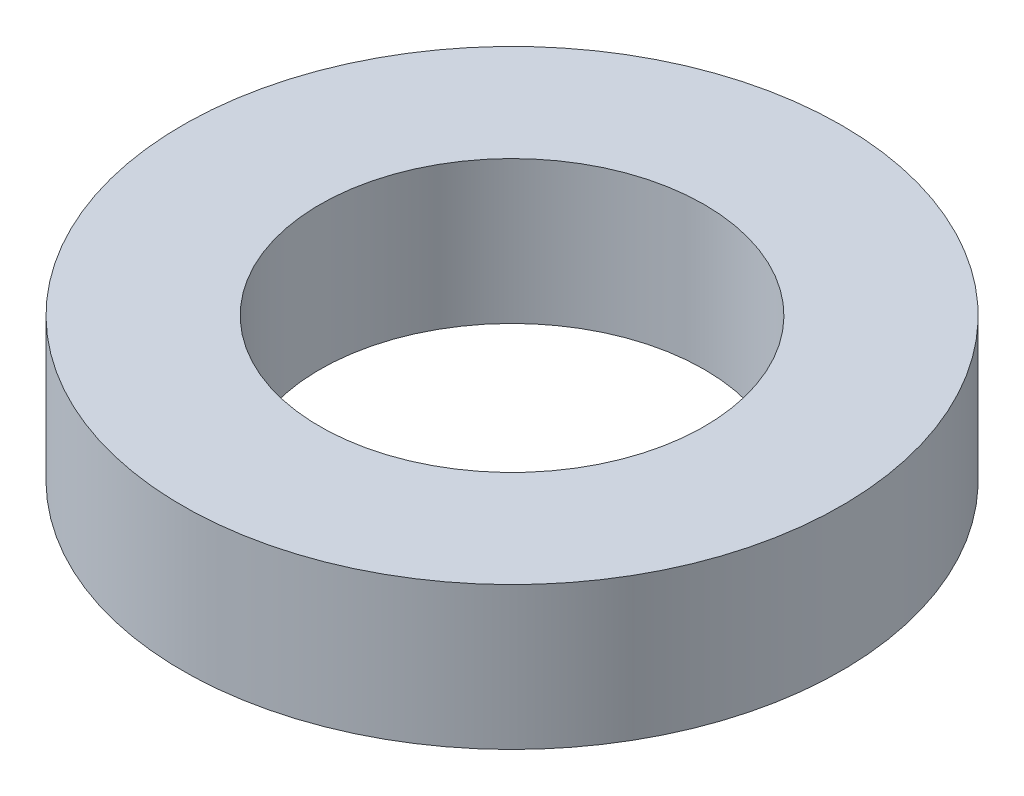
from build123d import *

# Parameters (mm, degrees)
SKETCH1_R           = 30
BOSS_EXTRUDE1_DEPTH = 13
SKETCH2_R           = 17.5
CUT_EXTRUDE1_DEPTH  = 45.373415465


with BuildPart() as part:
    # Sketch1 → Boss-Extrude1 (new body)
    with BuildSketch(Plane(origin=(0, 0, 0), x_dir=(1, 0, 0), z_dir=(0, 1, 0))):
        Circle(SKETCH1_R)
    extrude(amount=BOSS_EXTRUDE1_DEPTH)

    # Sketch2 → Cut-Extrude1 (cut, through all)
    with BuildSketch(Plane(origin=(0, 0, 0), x_dir=(1, 0, 0), z_dir=(0, 1, 0))):
        Circle(SKETCH2_R)
    extrude(amount=CUT_EXTRUDE1_DEPTH, mode=Mode.SUBTRACT)


solid = part.part
